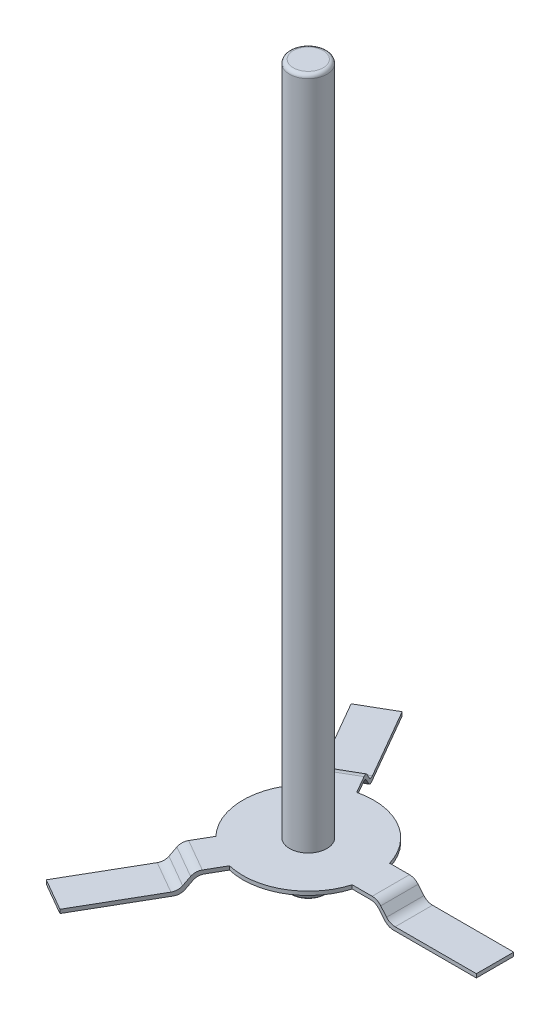
from build123d import *

# Parameters (mm, degrees)
SKETCH_1_R               = 0.5
EXTRUDE_1_DEPTH          = 19.15
SKETCH_2_R               = 1.75
SKETCH_2_R_2             = 0.5
EXTRUDE_2_DEPTH          = 0.1
EXTRUDE_3_DEPTH          = 0.5
PATTERN_CIRCULAR_1_COUNT = 3
FILLET_2_R               = 0.3
FILLET_3_R               = 0.1


with BuildPart() as part:
    # Эскиз1 → Бобышка-Вытянуть1 (new body)
    with BuildSketch(Plane(origin=(0, 0, 0), x_dir=(1, 0, 0), z_dir=(0, 1, 0))):
        Circle(SKETCH_1_R)
    extrude(amount=EXTRUDE_1_DEPTH)

    # Эскиз2 → Бобышка-Вытянуть2 (add)
    with BuildSketch(Plane(origin=(0, 1, 0), x_dir=(1, 0, 0), z_dir=(0, 1, 0))):
        Circle(SKETCH_2_R)
        Circle(SKETCH_2_R_2, mode=Mode.SUBTRACT)
    extrude(amount=EXTRUDE_2_DEPTH)

    # Эскиз3 → Бобышка-Вытянуть3 (add, symmetric)
    with BuildSketch(Plane.XY):
        Polygon((1.5, 1), (2.303369234, 1), (2.639009087, 0.6), (5, 0.6), (5, 0.7), (2.685639852, 0.7), (2.35, 1.1), (1.5, 1.1), align=None)
    extrude_3 = extrude(amount=EXTRUDE_3_DEPTH, both=True)

    # Круговой массив1: Бобышка-Вытянуть3 ×3 about axis
    pattern_circular_1_axis = Axis((0, 1.1, 0), (0, 1, 0))
    for i in range(1, PATTERN_CIRCULAR_1_COUNT):
        add(extrude_3.rotate(pattern_circular_1_axis, i * 360 / PATTERN_CIRCULAR_1_COUNT))

    # Скругление2
    fillet_2_edges = [part.edges().sort_by_distance(p)[0] for p in [
        (-1.175, 1.1, -2.035159699),
        (-1.342819926, 0.7, -2.325832338),
        (-1.319504543, 0.6, -2.28544891),
        (-1.151684617, 1, -1.994776271),
        (2.639009087, 0.6, 0),
        (2.303369234, 1, 0),
        (2.685639852, 0.7, 0),
        (2.35, 1.1, 0),
        (-1.151684617, 1, 1.994776271),
        (-1.319504543, 0.6, 2.28544891),
        (-1.342819926, 0.7, 2.325832338),
        (-1.175, 1.1, 2.035159699),
    ]]
    fillet(fillet_2_edges, radius=FILLET_2_R)

    # Скругление3
    fillet_3_edges = [part.edges().sort_by_distance(p)[0] for p in [
        (-0.5, 19.15, 0),
        (-0.5, 0, 0),
    ]]
    fillet(fillet_3_edges, radius=FILLET_3_R)


solid = part.part
